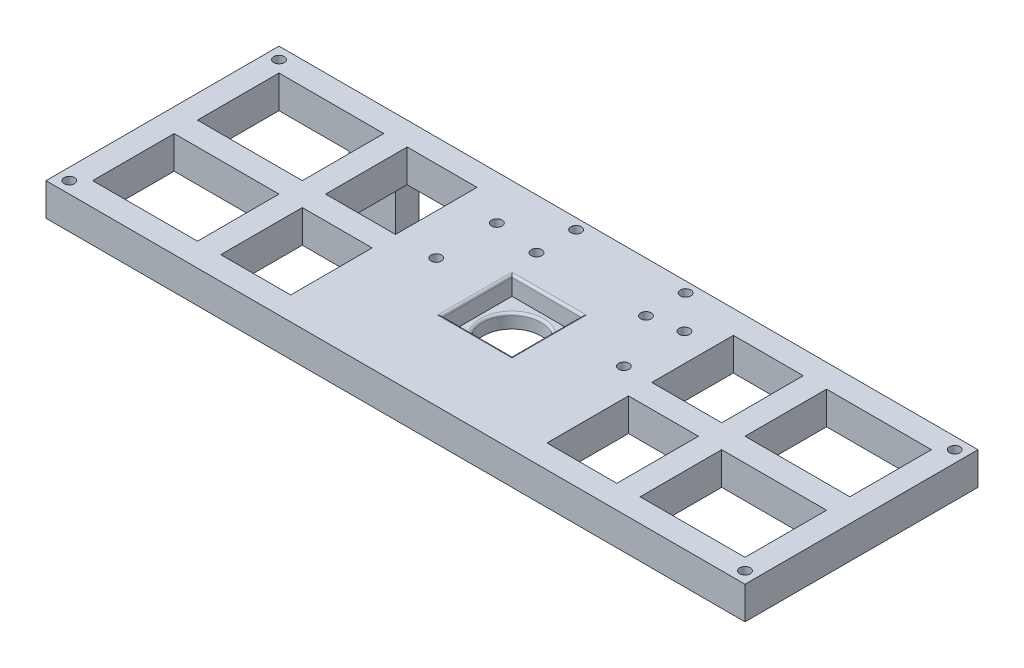
from build123d import *

# Parameters (mm, degrees)
SKETCH_1_W           = 300
SKETCH_1_H           = 100
EXTRUDE_1_DEPTH      = 16
SKETCH_2_W           = 30
SKETCH_2_H           = 30
CUT_EXTRUDE_1_DEPTH  = 8
SKETCH_3_R           = 12.5
CUT_EXTRUDE_2_DEPTH  = 14
CUT_EXTRUDE_3_REACH  = 318.632
SKETCH_4_W           = 50
SKETCH_4_H           = 35
SKETCH_7_W           = 35
SKETCH_7_H           = 16
EXTRUDE_2_DEPTH      = 20
SKETCH_8_W           = 35
SKETCH_8_H           = 16
EXTRUDE_3_DEPTH      = 20
SKETCH_9_W           = 20
SKETCH_9_H           = 10
EXTRUDE_4_DEPTH      = 25
FILLET_1_R           = 1
FILLET_2_R           = 1
SKETCH_13_W          = 35
SKETCH_13_H          = 16
EXTRUDE_6_DEPTH      = 4
SKETCH_14_W          = 35
SKETCH_14_H          = 16
EXTRUDE_7_DEPTH      = 4
SKETCH_17_W          = 35
SKETCH_17_H          = 16
EXTRUDE_8_DEPTH      = 1
SKETCH_18_W          = 35
SKETCH_18_H          = 16
EXTRUDE_9_DEPTH      = 1
SKETCH_19_R          = 2.25
CUT_EXTRUDE_8_DEPTH  = 5
CUT_EXTRUDE_START    = -7
SKETCH_20_R          = 2.25
CUT_EXTRUDE_9_DEPTH  = 7
SKETCH_21_R          = 1.45
CUT_EXTRUDE_10_DEPTH = 5
SKETCH_22_R          = 2.25
CUT_EXTRUDE_11_DEPTH = 5
SKETCH_23_R          = 1.45
CUT_EXTRUDE_12_DEPTH = 5
SKETCH_24_R          = 2.25
CUT_EXTRUDE_13_DEPTH = 5
CUT_EXTRUDE_15_DEPTH = 2
SKETCH_27_R          = 1.5
CUT_EXTRUDE_16_DEPTH = 4


with BuildPart() as part:
    # 草图1 → 凸台-拉伸1 (new body)
    with BuildSketch(Plane(origin=(0, 0, 0), x_dir=(1, 0, 0), z_dir=(0, 1, 0))):
        with Locations((-150, 50)):
            Rectangle(SKETCH_1_W, SKETCH_1_H)
    extrude(amount=EXTRUDE_1_DEPTH)

    # 草图2 → 切除-拉伸1 (cut)
    with BuildSketch(Plane(origin=(0, 16, 0), x_dir=(1, 0, 0), z_dir=(0, 1, 0))):
        with Locations((-150, 50)):
            Rectangle(SKETCH_2_W, SKETCH_2_H)
    extrude(amount=-CUT_EXTRUDE_1_DEPTH, mode=Mode.SUBTRACT)

    # 草图3 → 切除-拉伸2 (cut)
    with BuildSketch(Plane(origin=(0, 8, 0), x_dir=(1, 0, 0), z_dir=(0, 1, 0))):
        with Locations((-150, 50)):
            Circle(SKETCH_3_R)
    extrude(amount=-CUT_EXTRUDE_2_DEPTH, mode=Mode.SUBTRACT)

    # 草图4 → 切除-拉伸3 (cut, up to next)
    with BuildSketch(Plane(origin=(0, 16, 0), x_dir=(1, 0, 0), z_dir=(0, 1, 0)), mode=Mode.PRIVATE) as cut_extrude_3_sk1:
        with Locations((-270, 72.5)):
            Rectangle(SKETCH_4_W, SKETCH_4_H)
    cut_extrude_3_tool1 = extrude(cut_extrude_3_sk1.sketch, amount=-CUT_EXTRUDE_3_REACH, mode=Mode.PRIVATE) & part.part
    # 草图4 → 切除-拉伸3 (cut, up to next)
    with BuildSketch(Plane(origin=(0, 16, 0), x_dir=(1, 0, 0), z_dir=(0, 1, 0)), mode=Mode.PRIVATE) as cut_extrude_3_sk2:
        with Locations((-270, 27.5)):
            Rectangle(SKETCH_4_W, SKETCH_4_H)
    cut_extrude_3_tool2 = extrude(cut_extrude_3_sk2.sketch, amount=-CUT_EXTRUDE_3_REACH, mode=Mode.PRIVATE) & part.part
    # 草图4 → 切除-拉伸3 (cut, up to next)
    with BuildSketch(Plane(origin=(0, 16, 0), x_dir=(1, 0, 0), z_dir=(0, 1, 0)), mode=Mode.PRIVATE) as cut_extrude_3_sk3:
        with Locations((-210, 72.5)):
            Rectangle(SKETCH_4_W, SKETCH_4_H)
    cut_extrude_3_tool3 = extrude(cut_extrude_3_sk3.sketch, amount=-CUT_EXTRUDE_3_REACH, mode=Mode.PRIVATE) & part.part
    # 草图4 → 切除-拉伸3 (cut, up to next)
    with BuildSketch(Plane(origin=(0, 16, 0), x_dir=(1, 0, 0), z_dir=(0, 1, 0)), mode=Mode.PRIVATE) as cut_extrude_3_sk4:
        with Locations((-210, 27.5)):
            Rectangle(SKETCH_4_W, SKETCH_4_H)
    cut_extrude_3_tool4 = extrude(cut_extrude_3_sk4.sketch, amount=-CUT_EXTRUDE_3_REACH, mode=Mode.PRIVATE) & part.part
    # 草图4 → 切除-拉伸3 (cut, up to next)
    with BuildSketch(Plane(origin=(0, 16, 0), x_dir=(1, 0, 0), z_dir=(0, 1, 0)), mode=Mode.PRIVATE) as cut_extrude_3_sk5:
        with Locations((-30, 27.5)):
            Rectangle(SKETCH_4_W, SKETCH_4_H)
    cut_extrude_3_tool5 = extrude(cut_extrude_3_sk5.sketch, amount=-CUT_EXTRUDE_3_REACH, mode=Mode.PRIVATE) & part.part
    # 草图4 → 切除-拉伸3 (cut, up to next)
    with BuildSketch(Plane(origin=(0, 16, 0), x_dir=(1, 0, 0), z_dir=(0, 1, 0)), mode=Mode.PRIVATE) as cut_extrude_3_sk6:
        with Locations((-90, 27.5)):
            Rectangle(SKETCH_4_W, SKETCH_4_H)
    cut_extrude_3_tool6 = extrude(cut_extrude_3_sk6.sketch, amount=-CUT_EXTRUDE_3_REACH, mode=Mode.PRIVATE) & part.part
    # 草图4 → 切除-拉伸3 (cut, up to next)
    with BuildSketch(Plane(origin=(0, 16, 0), x_dir=(1, 0, 0), z_dir=(0, 1, 0)), mode=Mode.PRIVATE) as cut_extrude_3_sk7:
        with Locations((-90, 72.5)):
            Rectangle(SKETCH_4_W, SKETCH_4_H)
    cut_extrude_3_tool7 = extrude(cut_extrude_3_sk7.sketch, amount=-CUT_EXTRUDE_3_REACH, mode=Mode.PRIVATE) & part.part
    # 草图4 → 切除-拉伸3 (cut, up to next)
    with BuildSketch(Plane(origin=(0, 16, 0), x_dir=(1, 0, 0), z_dir=(0, 1, 0)), mode=Mode.PRIVATE) as cut_extrude_3_sk8:
        with Locations((-30, 72.5)):
            Rectangle(SKETCH_4_W, SKETCH_4_H)
    cut_extrude_3_tool8 = extrude(cut_extrude_3_sk8.sketch, amount=-CUT_EXTRUDE_3_REACH, mode=Mode.PRIVATE) & part.part
    add(cut_extrude_3_tool1.solids().sort_by_distance((-270, 16, -72.5))[0], mode=Mode.SUBTRACT)
    add(cut_extrude_3_tool2.solids().sort_by_distance((-270, 16, -27.5))[0], mode=Mode.SUBTRACT)
    add(cut_extrude_3_tool3.solids().sort_by_distance((-210, 16, -72.5))[0], mode=Mode.SUBTRACT)
    add(cut_extrude_3_tool4.solids().sort_by_distance((-210, 16, -27.5))[0], mode=Mode.SUBTRACT)
    add(cut_extrude_3_tool5.solids().sort_by_distance((-30, 16, -27.5))[0], mode=Mode.SUBTRACT)
    add(cut_extrude_3_tool6.solids().sort_by_distance((-90, 16, -27.5))[0], mode=Mode.SUBTRACT)
    add(cut_extrude_3_tool7.solids().sort_by_distance((-90, 16, -72.5))[0], mode=Mode.SUBTRACT)
    add(cut_extrude_3_tool8.solids().sort_by_distance((-30, 16, -72.5))[0], mode=Mode.SUBTRACT)

    # 草图7 → 凸台-拉伸2 (add)
    with BuildSketch(Plane.ZY.offset(185)):
        with Locations((-27.5, 8)):
            Rectangle(SKETCH_7_W, SKETCH_7_H)
        with Locations((-72.5, 8)):
            Rectangle(SKETCH_7_W, SKETCH_7_H)
    extrude(amount=EXTRUDE_2_DEPTH)

    # 草图8 → 凸台-拉伸3 (add)
    with BuildSketch(Plane(origin=(-115, 0, 0), x_dir=(0, 0, -1), z_dir=(1, 0, 0))):
        with Locations((27.5, 8)):
            Rectangle(SKETCH_8_W, SKETCH_8_H)
        with Locations((72.5, 8)):
            Rectangle(SKETCH_8_W, SKETCH_8_H)
    extrude(amount=EXTRUDE_3_DEPTH)

    # 草图9 → 凸台-拉伸4 (add)
    with BuildSketch(Plane.XZ):
        with Locations((-250, -95)):
            Rectangle(SKETCH_9_W, SKETCH_9_H)
    extrude(amount=EXTRUDE_4_DEPTH)

    # 圆角1
    fillet_1_edges = [part.edges().sort_by_distance(p)[0] for p in [
        (-162.5, 8, -50),
    ]]
    fillet(fillet_1_edges, radius=FILLET_1_R)

    # 圆角2
    fillet_2_edges = [part.edges().sort_by_distance(p)[0] for p in [
        (-135, 16, -50),
        (-150, 16, -65),
        (-150, 16, -35),
        (-165, 16, -50),
    ]]
    fillet(fillet_2_edges, radius=FILLET_2_R)

    # 草图13 → 凸台-拉伸6 (add)
    with BuildSketch(Plane.ZY.offset(5)):
        with Locations((-72.5, 8)):
            Rectangle(SKETCH_13_W, SKETCH_13_H)
        with Locations((-27.5, 8)):
            Rectangle(SKETCH_13_W, SKETCH_13_H)
    extrude(amount=EXTRUDE_6_DEPTH)

    # 草图14 → 凸台-拉伸7 (add)
    with BuildSketch(Plane(origin=(-295, 0, 0), x_dir=(0, 0, -1), z_dir=(1, 0, 0))):
        with Locations((72.5, 8)):
            Rectangle(SKETCH_14_W, SKETCH_14_H)
        with Locations((27.5, 8)):
            Rectangle(SKETCH_14_W, SKETCH_14_H)
    extrude(amount=EXTRUDE_7_DEPTH)

    # 草图17 → 凸台-拉伸8 (add)
    with BuildSketch(Plane(origin=(-291, 0, 0), x_dir=(0, 0, -1), z_dir=(1, 0, 0))):
        with Locations((27.5, 8)):
            Rectangle(SKETCH_17_W, SKETCH_17_H)
        with Locations((72.5, 8)):
            Rectangle(SKETCH_17_W, SKETCH_17_H)
    extrude(amount=EXTRUDE_8_DEPTH)

    # 草图18 → 凸台-拉伸9 (add)
    with BuildSketch(Plane.ZY.offset(9)):
        with Locations((-27.5, 8)):
            Rectangle(SKETCH_18_W, SKETCH_18_H)
        with Locations((-72.5, 8)):
            Rectangle(SKETCH_18_W, SKETCH_18_H)
    extrude(amount=EXTRUDE_9_DEPTH)

    # 草图19 → 切除-拉伸8 (cut)
    with BuildSketch(Plane(origin=(0, 16, 0), x_dir=(1, 0, 0), z_dir=(0, 1, 0))):
        with Locations((-295, 95)):
            Circle(SKETCH_19_R)
        with Locations((-295, 5)):
            Circle(SKETCH_19_R)
        with Locations((-5, 5)):
            Circle(SKETCH_19_R)
        with Locations((-5, 95)):
            Circle(SKETCH_19_R)
    extrude(amount=-CUT_EXTRUDE_8_DEPTH, mode=Mode.SUBTRACT)

    # 草图20 → 切除-拉伸9 (cut)
    with BuildSketch(Plane.XZ.offset(CUT_EXTRUDE_START)):
        with Locations((-295, -95)):
            Circle(SKETCH_20_R)
        with Locations((-295, -5)):
            Circle(SKETCH_20_R)
        with Locations((-5, -95)):
            Circle(SKETCH_20_R)
        with Locations((-5, -5)):
            Circle(SKETCH_20_R)
    extrude(amount=CUT_EXTRUDE_9_DEPTH, mode=Mode.SUBTRACT)

    # 草图21 → 切除-拉伸10 (cut)
    with BuildSketch(Plane(origin=(-100.276222054, 16, -200.091791604), x_dir=(-0.00184091553368713, 0, -0.9999983055135633), z_dir=(0, 1, 0))):
        with Locations((-104.55346365, 20.916287483)):
            Circle(SKETCH_21_R)
        with Locations((-121.553434843, 20.947583047)):
            Circle(SKETCH_21_R)
        with Locations((-121.456786778, 67.947583047)):
            Circle(SKETCH_21_R)
        with Locations((-104.456815584, 67.916287483)):
            Circle(SKETCH_21_R)
    extrude(amount=-CUT_EXTRUDE_10_DEPTH, mode=Mode.SUBTRACT)

    # 草图22 → 切除-拉伸11 (cut)
    with BuildSketch(Plane(origin=(0, 16, 0), x_dir=(1, 0, 0), z_dir=(0, 1, 0))):
        with Locations((-168.00009828, 95.510124872)):
            Circle(SKETCH_22_R)
        with Locations((-168.00009828, 78.510124872)):
            Circle(SKETCH_22_R)
        with Locations((-121, 95.5)):
            Circle(SKETCH_22_R)
        with Locations((-121, 78.5)):
            Circle(SKETCH_22_R)
    extrude(amount=-CUT_EXTRUDE_11_DEPTH, mode=Mode.SUBTRACT)

    # 草图23 → 切除-拉伸12 (cut)
    with BuildSketch(Plane(origin=(-100.276222054, 16, -200.091791604), x_dir=(-0.00184091553368713, 0, -0.9999983055135633), z_dir=(0, 1, 0))):
        with Locations((-119.079211897, 6.943004481)):
            Circle(SKETCH_23_R)
        with Locations((-145.07916784, 6.990868285)):
            Circle(SKETCH_23_R)
        with Locations((-144.931009437, 87.471558467)):
            Circle(SKETCH_23_R)
        with Locations((-118.931053493, 87.423694663)):
            Circle(SKETCH_23_R)
    extrude(amount=-CUT_EXTRUDE_12_DEPTH, mode=Mode.SUBTRACT)

    # 草图24 → 切除-拉伸13 (cut)
    with BuildSketch(Plane(origin=(0, 16, 0), x_dir=(1, 0, 0), z_dir=(0, 1, 0))):
        with Locations((-187.480826555, 81)):
            Circle(SKETCH_24_R)
        with Locations((-187.480826555, 55)):
            Circle(SKETCH_24_R)
        with Locations((-107, 81)):
            Circle(SKETCH_24_R)
        with Locations((-107, 55)):
            Circle(SKETCH_24_R)
    extrude(amount=-CUT_EXTRUDE_13_DEPTH, mode=Mode.SUBTRACT)

    # 草图26 → 切除-拉伸15 (cut)
    with BuildSketch(Plane.XZ):
        Polygon((-260, -90), (-290, -90), (-290, -55), (-245, -55), (-245, -90), (-240, -90), (-240, -100), (0, -100), (0, 0), (-300, 0), (-300, -100), (-260, -100), align=None)
    extrude(amount=-CUT_EXTRUDE_15_DEPTH, mode=Mode.SUBTRACT)

    # 草图27 → 切除-拉伸16 (cut)
    with BuildSketch(Plane(origin=(0, 11, 0), x_dir=(1, 0, 0), z_dir=(0, 1, 0))):
        with Locations((-168.00009828, 95.510124872)):
            Circle(SKETCH_27_R)
        with Locations((-187.480826555, 81)):
            Circle(SKETCH_27_R)
        with Locations((-168.00009828, 78.510124872)):
            Circle(SKETCH_27_R)
        with Locations((-121, 95.5)):
            Circle(SKETCH_27_R)
        with Locations((-121, 78.5)):
            Circle(SKETCH_27_R)
        with Locations((-187.480826555, 55)):
            Circle(SKETCH_27_R)
        with Locations((-107, 55)):
            Circle(SKETCH_27_R)
        with Locations((-107, 81)):
            Circle(SKETCH_27_R)
        with Locations((-5, 95)):
            Circle(SKETCH_27_R)
        with Locations((-5, 5)):
            Circle(SKETCH_27_R)
        with Locations((-295, 5)):
            Circle(SKETCH_27_R)
        with Locations((-295, 95)):
            Circle(SKETCH_27_R)
    extrude(amount=-CUT_EXTRUDE_16_DEPTH, mode=Mode.SUBTRACT)


solid = part.part
